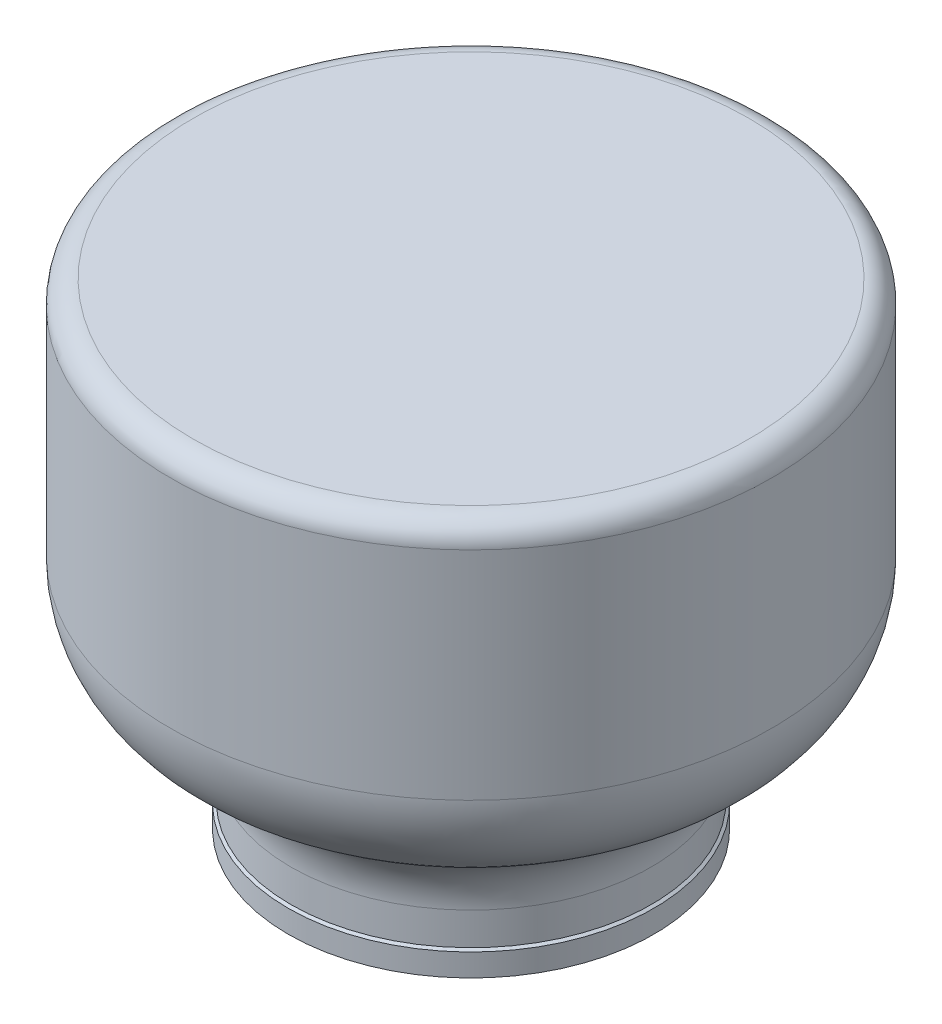
from build123d import *


with BuildPart() as part:
    # Sketch1 → Revolve1 (revolve)
    with BuildSketch(Plane.XY):
        with BuildLine():
            Line((0, 63.427876097), (37, 63.427876097))
            ThreePointArc((37, 63.427876097), (39.121320344, 62.54919644), (40, 60.427876097))
            Line((40, 60.427876097), (40, 31.556288966))
            ThreePointArc((40, 31.556288966), (38.188122658, 24.409721904), (33.190210564, 18.989648567))
            Line((33.190210564, 18.989648567), (28.539859624, 15.958818353))
            ThreePointArc((28.539859624, 15.958818353), (25.207918228, 12.345436129), (24, 7.581058088))
            Line((24, 7.581058088), (24, 3.25))
            Line((24, 3.25), (24.35, 3))
            Line((24.35, 3), (24.35, 0))
            Line((24.35, 0), (22.5, 0))
            Line((22.5, 0), (22.5, 12.5))
            ThreePointArc((22.5, 12.5), (22.353553391, 12.853553391), (22, 13))
            Line((22, 13), (0, 13))
            Line((0, 13), (0, 63.427876097))
        make_face()
    revolve(axis=Axis((0, 0, 0), (0, 1, 0)))


solid = part.part
